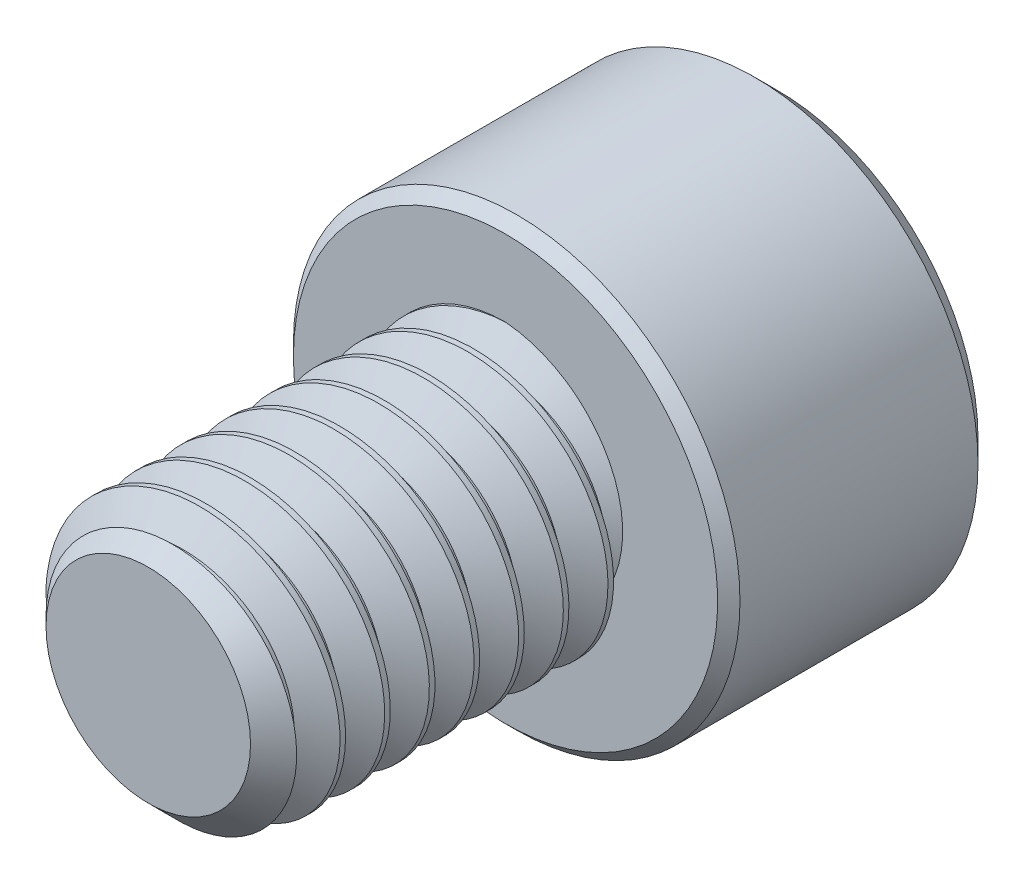
from build123d import *

# Parameters (mm, degrees)
SKETCH1_R          = 2.413
EXTRUDE1_DEPTH     = 6.35
CHAMFER3_SIZE      = 0.5953125
CUT_SWEEP1_PITCH   = 0.79375
SKETCH6_R          = 3.96875
EXTRUDE2_DEPTH     = 4.826
CUT_EXTRUDE1_DEPTH = 2.9765625
CHAMFER1_SIZE      = 0.396875
CHAMFER2_SIZE      = 0.1984375


with BuildPart() as part:
    # Sketch1 → Extrude1 (new body)
    with BuildSketch(Plane.XY):
        Circle(SKETCH1_R)
    extrude(amount=-EXTRUDE1_DEPTH)

    # Chamfer3
    chamfer3_edges = [part.edges().sort_by_distance(p)[0] for p in [
        (-2.413, 0, 0),
    ]]
    chamfer(chamfer3_edges, length=CHAMFER3_SIZE)

    # Cut-Sweep1: the profile of Sketch3 profile screwed along a right-hand helix of 9 turns, 6 arcs to a turn; built about Z, then put on its axis
    cut_sweep1_z = Axis((0, 0, 0), (0, 0, 1))
    cut_sweep1_corners = [(2.4133, 0, -0.694704455), (1.897444252, 0, -0.396875), (1.897444252, 0, -0.29765625), (2.4133, 0, 0.000173205)]
    with BuildLine(mode=Mode.PRIVATE) as cut_sweep1_profile:
        Line(cut_sweep1_corners[0], cut_sweep1_corners[1])
        Line(cut_sweep1_corners[1], cut_sweep1_corners[2])
        Line(cut_sweep1_corners[2], cut_sweep1_corners[3])
        Line(cut_sweep1_corners[3], cut_sweep1_corners[0])
    cut_sweep1_cap = Face(cut_sweep1_profile.wire())
    cut_sweep1_turn_angles = [0, 30, 60, 90, 120, 150, 180, 210, 240, 270, 300, 330, 360]
    cut_sweep1_turn_weights = [1, 0.8660254037844387, 1, 0.8660254037844387, 1, 0.8660254037844387, 1, 0.8660254037844387, 1, 0.8660254037844387, 1, 0.8660254037844387, 1]
    cut_sweep1_turn_rails = [Edge.make_bspline([Vector(p[0], p[1], 0).rotate(cut_sweep1_z, cut_sweep1_turn_angles[k]) / cut_sweep1_turn_weights[k] + Vector(0, 0, p[2] + CUT_SWEEP1_PITCH * cut_sweep1_turn_angles[k] / 360) for k in range(13)], [0, 0, 0, 1, 1, 2, 2, 3, 3, 4, 4, 5, 5, 6, 6, 6], 2, cut_sweep1_turn_weights) for p in cut_sweep1_corners]
    cut_sweep1_turn_sides = [Face.make_surface_from_curves(cut_sweep1_turn_rails[p[0]], cut_sweep1_turn_rails[p[1]]) for p in [(0, 1), (1, 2), (2, 3), (3, 0)]]
    cut_sweep1 = Plane(origin=(0, 0, 0), x_dir=(0, 1, 0), z_dir=(0, 0, -1)) * Solid(Shell([*[p.moved(Location((0, 0, CUT_SWEEP1_PITCH * i))) for i in range(9) for p in cut_sweep1_turn_sides], cut_sweep1_cap, cut_sweep1_cap.rotate(cut_sweep1_z, 3240).moved(Location((0, 0, CUT_SWEEP1_PITCH * 3240 / 360)))]))
    add(cut_sweep1, mode=Mode.SUBTRACT)

    # Sketch6 → Extrude2 (add)
    with BuildSketch(Plane(origin=(0, 0, -6.35), x_dir=(-1, 0, 0), z_dir=(0, 0, -1))):
        Circle(SKETCH6_R)
    extrude(amount=EXTRUDE2_DEPTH)

    # Sketch7 → Cut-Extrude1 (cut)
    with BuildSketch(Plane(origin=(0, 0, -11.176), x_dir=(-1, 0, 0), z_dir=(0, 0, -1))):
        Polygon((0, 2.291358881), (-1.984375, 1.14567944), (-1.984375, -1.14567944), (0, -2.291358881), (1.984375, -1.14567944), (1.984375, 1.14567944), align=None)
    extrude(amount=-CUT_EXTRUDE1_DEPTH, mode=Mode.SUBTRACT)

    # Cut-Extrude2 cone 1 section (through the dimple's axis) → Cut-Extrude2 (revolve, cut)
    with BuildSketch(Plane(origin=(0, 0, -11.176), x_dir=(0, 1, 0), z_dir=(1, 0, 0))):
        Polygon((0, 0), (2.291358881, 0), (0, 2.291358881), align=None)
    revolve(axis=Axis((0, 0, -11.176), (0, 0, 1)), mode=Mode.SUBTRACT)

    # Chamfer1
    chamfer1_edges = [part.edges().sort_by_distance(p)[0] for p in [
        (3.96875, 0, -11.176),
    ]]
    chamfer(chamfer1_edges, length=CHAMFER1_SIZE)

    # Chamfer2
    chamfer2_edges = [part.edges().sort_by_distance(p)[0] for p in [
        (3.96875, 0, -6.35),
    ]]
    chamfer(chamfer2_edges, length=CHAMFER2_SIZE)


solid = part.part
